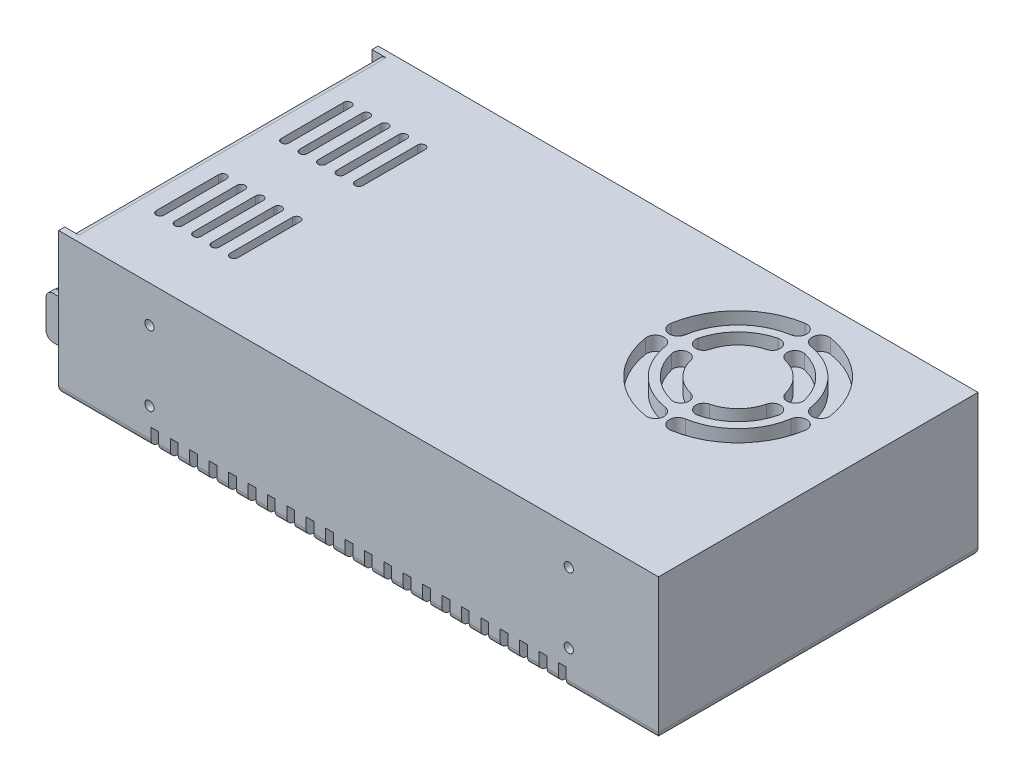
from build123d import *

# Parameters (mm, degrees)
SKETCH1_W                 = 214.63
SKETCH1_H                 = 114.3
BOSS_EXTRUDE1_DEPTH       = 50.8
SKETCH2_W                 = 2.54
SKETCH2_H                 = 109.9312
CUT_EXTRUDE1_DEPTH        = 41.91
SKETCH3_W                 = 89.408
SKETCH3_H                 = 15.24
BOSS_EXTRUDE2_DEPTH       = 12.7
CUT_EXTRUDE3_DEPTH        = 25.4
SKETCH5_W                 = 6.35
SKETCH5_H                 = 8.89
BOSS_EXTRUDE3_DEPTH       = 8.89
SKETCH6_W                 = 8.128
SKETCH6_H                 = 8.128
CUT_EXTRUDE4_DEPTH        = 134.267712478
SKETCH7_R                 = 1.905
CUT_EXTRUDE5_DEPTH        = 0.254
SKETCH8_R                 = 1.905
BOSS_EXTRUDE4_DEPTH       = 2.54
SKETCH9_R                 = 3.81
BOSS_EXTRUDE5_DEPTH       = 3.81
FILLET1_R                 = 1.27
CUT_EXTRUDE6_DEPTH        = 5.08
CUT_EXTRUDE7_DEPTH        = 5.08
FILLET2_R                 = 2.54
CUT_EXTRUDE8_DEPTH        = 6.35
SKETCH13_W                = 89.408
SKETCH13_H                = 15.24
BOSS_EXTRUDE6_DEPTH       = 0.254
FILLET3_R                 = 2.54
SKETCH14_W                = 1.831730769
SKETCH14_H                = 0.488461538
SKETCH14_W_2              = 3.175
SKETCH14_H_2              = 0.427403847
SKETCH14_W_3              = 0.314102564
SKETCH14_H_3              = 4.532051282
CUT_EXTRUDE9_DEPTH        = 0.254
M4X0_7_TAPPED_HOLE1_D     = 3.3
M4X0_7_TAPPED_HOLE1_DEPTH = 9.906
M4X0_7_TAPPED_HOLE1_TIP   = 0.991420021
M4X0_7_TAPPED_HOLE2_D     = 3.3
M4X0_7_TAPPED_HOLE2_DEPTH = 9.906
M4X0_7_TAPPED_HOLE2_TIP   = 0.991420021
M4X0_7_TAPPED_HOLE3_D     = 3.3
M4X0_7_TAPPED_HOLE3_DEPTH = 9.906
M4X0_7_TAPPED_HOLE3_TIP   = 0.991420021


with BuildPart() as part:
    # Sketch1 → Boss-Extrude1 (new body)
    with BuildSketch(Plane(origin=(0, 0, 0), x_dir=(1, 0, 0), z_dir=(0, 1, 0))):
        Rectangle(SKETCH1_W, SKETCH1_H)
    extrude(amount=BOSS_EXTRUDE1_DEPTH)

    # Sketch2 → Cut-Extrude1 (cut)
    with BuildSketch(Plane(origin=(0, 50.8, 0), x_dir=(1, 0, 0), z_dir=(0, 1, 0))):
        with Locations((-106.045, 0)):
            Rectangle(SKETCH2_W, SKETCH2_H)
    extrude(amount=-CUT_EXTRUDE1_DEPTH, mode=Mode.SUBTRACT)

    # Sketch3 → Boss-Extrude2 (add)
    with BuildSketch(Plane.ZY.offset(104.775)):
        with Locations((6.5532, 16.8402)):
            Rectangle(SKETCH3_W, SKETCH3_H)
    extrude(amount=BOSS_EXTRUDE2_DEPTH)

    # Sketch4 → Cut-Extrude3 (cut)
    with BuildSketch(Plane.ZY.offset(104.775)):
        Polygon((-38.1508, 9.2202), (-54.9656, 9.2202), (-54.9656, 27.0002), (54.9656, 27.0002), (54.9656, 9.2202), (51.2572, 9.2202), (51.2572, 24.4602), (-38.1508, 24.4602), align=None)
    extrude(amount=-CUT_EXTRUDE3_DEPTH, mode=Mode.SUBTRACT)

    # Sketch5 → Boss-Extrude3 (add)
    with BuildSketch(Plane(origin=(0, 9.2202, 0), x_dir=(1, 0, 0), z_dir=(0, 1, 0))):
        with Locations((-100.33, 43.4086)):
            Rectangle(SKETCH5_W, SKETCH5_H)
    extrude(amount=BOSS_EXTRUDE3_DEPTH)

    # Sketch6 → Cut-Extrude4 (cut, through all)
    with BuildSketch(Plane(origin=(0, 24.4602, 0), x_dir=(1, 0, 0), z_dir=(0, 1, 0))):
        with Locations((-113.411, 32.0548)):
            Rectangle(SKETCH6_W, SKETCH6_H)
        with Locations((-113.411, 22.4028)):
            Rectangle(SKETCH6_W, SKETCH6_H)
        with Locations((-113.411, 12.7508)):
            Rectangle(SKETCH6_W, SKETCH6_H)
        with Locations((-113.411, 3.0988)):
            Rectangle(SKETCH6_W, SKETCH6_H)
        with Locations((-113.411, -6.5532)):
            Rectangle(SKETCH6_W, SKETCH6_H)
        with Locations((-113.411, -16.2052)):
            Rectangle(SKETCH6_W, SKETCH6_H)
        with Locations((-113.411, -25.8572)):
            Rectangle(SKETCH6_W, SKETCH6_H)
        with Locations((-113.411, -35.5092)):
            Rectangle(SKETCH6_W, SKETCH6_H)
        with Locations((-113.411, -45.1612)):
            Rectangle(SKETCH6_W, SKETCH6_H)
    extrude(amount=-CUT_EXTRUDE4_DEPTH, mode=Mode.SUBTRACT)

    # Sketch7 → Cut-Extrude5 (cut)
    with BuildSketch(Plane.ZY.offset(103.505)):
        with Locations((-43.4086, 13.6652)):
            Circle(SKETCH7_R)
    extrude(amount=-CUT_EXTRUDE5_DEPTH, mode=Mode.SUBTRACT)

    # Sketch8 → Boss-Extrude4 (add)
    with BuildSketch(Plane.ZY.offset(109.347)):
        with Locations(Location((-32.0548, 16.8402, 0), (0, 0, 180))):
            Circle(SKETCH8_R)
        with Locations(Location((-22.4028, 16.8402, 0), (0, 0, 180))):
            Circle(SKETCH8_R)
        with Locations(Location((-12.7508, 16.8402, 0), (0, 0, 180))):
            Circle(SKETCH8_R)
        with Locations(Location((-3.0988, 16.8402, 0), (0, 0, 180))):
            Circle(SKETCH8_R)
        with Locations(Location((6.5532, 16.8402, 0), (0, 0, 180))):
            Circle(SKETCH8_R)
        with Locations(Location((16.2052, 16.8402, 0), (0, 0, 180))):
            Circle(SKETCH8_R)
        with Locations(Location((25.8572, 16.8402, 0), (0, 0, 180))):
            Circle(SKETCH8_R)
        with Locations(Location((35.5092, 16.8402, 0), (0, 0, 180))):
            Circle(SKETCH8_R)
        with Locations(Location((45.1612, 16.8402, 0), (0, 0, 180))):
            Circle(SKETCH8_R)
    extrude(amount=BOSS_EXTRUDE4_DEPTH)

    # Sketch9 → Boss-Extrude5 (add)
    with BuildSketch(Plane.ZY.offset(111.887)):
        with Locations(Location((-32.0548, 16.8402, 0), (0, 0, 180))):
            Circle(SKETCH9_R)
        with Locations(Location((-22.4028, 16.8402, 0), (0, 0, 180))):
            Circle(SKETCH9_R)
        with Locations(Location((-12.7508, 16.8402, 0), (0, 0, 180))):
            Circle(SKETCH9_R)
        with Locations(Location((-3.0988, 16.8402, 0), (0, 0, 180))):
            Circle(SKETCH9_R)
        with Locations(Location((6.5532, 16.8402, 0), (0, 0, 180))):
            Circle(SKETCH9_R)
        with Locations(Location((16.2052, 16.8402, 0), (0, 0, 180))):
            Circle(SKETCH9_R)
        with Locations(Location((25.8572, 16.8402, 0), (0, 0, 180))):
            Circle(SKETCH9_R)
        with Locations(Location((35.5092, 16.8402, 0), (0, 0, 180))):
            Circle(SKETCH9_R)
        with Locations(Location((45.1612, 16.8402, 0), (0, 0, 180))):
            Circle(SKETCH9_R)
    extrude(amount=BOSS_EXTRUDE5_DEPTH)

    # Fillet1
    fillet1_edges = [part.edges().sort_by_distance(p)[0] for p in [
        (-115.697, 16.8402, -28.2448),
        (-115.697, 16.8402, -18.5928),
        (-115.697, 16.8402, -8.9408),
        (-115.697, 16.8402, 0.7112),
        (-115.697, 16.8402, 10.3632),
        (-115.697, 16.8402, 20.0152),
        (-115.697, 16.8402, 29.6672),
        (-115.697, 16.8402, 39.3192),
        (-115.697, 16.8402, 48.9712),
    ]]
    fillet(fillet1_edges, radius=FILLET1_R)

    # Sketch10 → Cut-Extrude6 (cut)
    with BuildSketch(Plane(origin=(0, 50.8, 0), x_dir=(1, 0, 0), z_dir=(0, 1, 0))):
        with BuildLine():
            ThreePointArc((73.119466646, 22.423886792), (69.441281733, 28.928281733), (62.936886792, 32.606466646))
            ThreePointArc((62.936886792, 32.606466646), (60.854086368, 36.069493485), (64.317113208, 38.15229391))
            ThreePointArc((64.317113208, 38.15229391), (73.482396988, 32.969396988), (78.66529391, 23.804113208))
            ThreePointArc((78.66529391, 23.804113208), (76.582493485, 20.341086368), (73.119466646, 22.423886792))
        make_face()
        with BuildLine():
            ThreePointArc((82.013181493, 22.624722359), (75.637658457, 35.124658457), (63.137722359, 41.500181493))
            ThreePointArc((63.137722359, 41.500181493), (60.554209796, 45.062249338), (64.116277641, 47.645761901))
            ThreePointArc((64.116277641, 47.645761901), (80.037983956, 39.524983956), (88.158761901, 23.603277641))
            ThreePointArc((88.158761901, 23.603277641), (85.575249338, 20.041209796), (82.013181493, 22.624722359))
        make_face()
        with BuildLine():
            ThreePointArc((73.119466646, 15.676113208), (76.582493485, 17.758913632), (78.66529391, 14.295886792))
            ThreePointArc((78.66529391, 14.295886792), (73.482396988, 5.130603012), (64.317113208, -0.05229391))
            ThreePointArc((64.317113208, -0.05229391), (60.854086368, 2.030506515), (62.936886792, 5.493533354))
            ThreePointArc((62.936886792, 5.493533354), (69.441281733, 9.171718267), (73.119466646, 15.676113208))
        make_face()
        with BuildLine():
            ThreePointArc((64.116277641, -9.545761901), (60.554209796, -6.962249338), (63.137722359, -3.400181493))
            ThreePointArc((63.137722359, -3.400181493), (75.637658457, 2.975341543), (82.013181493, 15.475277641))
            ThreePointArc((82.013181493, 15.475277641), (85.575249338, 18.058790204), (88.158761901, 14.496722359))
            ThreePointArc((88.158761901, 14.496722359), (80.037983956, -1.424983956), (64.116277641, -9.545761901))
        make_face()
        with BuildLine():
            ThreePointArc((46.006533354, 15.676113208), (49.684718267, 9.171718267), (56.189113208, 5.493533354))
            ThreePointArc((56.189113208, 5.493533354), (58.271913632, 2.030506515), (54.808886792, -0.05229391))
            ThreePointArc((54.808886792, -0.05229391), (45.643603012, 5.130603012), (40.46070609, 14.295886792))
            ThreePointArc((40.46070609, 14.295886792), (42.543506515, 17.758913632), (46.006533354, 15.676113208))
        make_face()
        with BuildLine():
            ThreePointArc((37.112818507, 15.475277641), (43.488341543, 2.975341543), (55.988277641, -3.400181493))
            ThreePointArc((55.988277641, -3.400181493), (58.571790204, -6.962249338), (55.009722359, -9.545761901))
            ThreePointArc((55.009722359, -9.545761901), (39.088016044, -1.424983956), (30.967238099, 14.496722359))
            ThreePointArc((30.967238099, 14.496722359), (33.550750662, 18.058790204), (37.112818507, 15.475277641))
        make_face()
        with BuildLine():
            ThreePointArc((46.006533354, 22.423886792), (42.543506515, 20.341086368), (40.46070609, 23.804113208))
            ThreePointArc((40.46070609, 23.804113208), (45.643603012, 32.969396988), (54.808886792, 38.15229391))
            ThreePointArc((54.808886792, 38.15229391), (58.271913632, 36.069493485), (56.189113208, 32.606466646))
            ThreePointArc((56.189113208, 32.606466646), (49.684718267, 28.928281733), (46.006533354, 22.423886792))
        make_face()
        with BuildLine():
            ThreePointArc((55.009722359, 47.645761901), (58.571790204, 45.062249338), (55.988277641, 41.500181493))
            ThreePointArc((55.988277641, 41.500181493), (43.488341543, 35.124658457), (37.112818507, 22.624722359))
            ThreePointArc((37.112818507, 22.624722359), (33.550750662, 20.041209796), (30.967238099, 23.603277641))
            ThreePointArc((30.967238099, 23.603277641), (39.088016044, 39.524983956), (55.009722359, 47.645761901))
        make_face()
    extrude(amount=-CUT_EXTRUDE6_DEPTH, mode=Mode.SUBTRACT)

    # Sketch11 → Cut-Extrude7 (cut)
    with BuildSketch(Plane(origin=(0, 50.8, 0), x_dir=(1, 0, 0), z_dir=(0, 1, 0))):
        with BuildLine():
            Line((-93.218, 33.528), (-93.218, 11.176))
            ThreePointArc((-93.218, 11.176), (-94.615, 9.779), (-96.012, 11.176))
            Line((-96.012, 11.176), (-96.012, 33.528))
            ThreePointArc((-96.012, 33.528), (-94.615, 34.925), (-93.218, 33.528))
        make_face()
        with BuildLine():
            Line((-93.218, -11.176), (-93.218, -33.528))
            ThreePointArc((-93.218, -33.528), (-94.615, -34.925), (-96.012, -33.528))
            Line((-96.012, -33.528), (-96.012, -11.176))
            ThreePointArc((-96.012, -11.176), (-94.615, -9.779), (-93.218, -11.176))
        make_face()
        with BuildLine():
            Line((-86.614, 33.528), (-86.614, 11.176))
            ThreePointArc((-86.614, 11.176), (-88.011, 9.779), (-89.408, 11.176))
            Line((-89.408, 11.176), (-89.408, 33.528))
            ThreePointArc((-89.408, 33.528), (-88.011, 34.925), (-86.614, 33.528))
        make_face()
        with BuildLine():
            Line((-86.614, -11.176), (-86.614, -33.528))
            ThreePointArc((-86.614, -33.528), (-88.011, -34.925), (-89.408, -33.528))
            Line((-89.408, -33.528), (-89.408, -11.176))
            ThreePointArc((-89.408, -11.176), (-88.011, -9.779), (-86.614, -11.176))
        make_face()
        with BuildLine():
            Line((-80.01, 33.528), (-80.01, 11.176))
            ThreePointArc((-80.01, 11.176), (-81.407, 9.779), (-82.804, 11.176))
            Line((-82.804, 11.176), (-82.804, 33.528))
            ThreePointArc((-82.804, 33.528), (-81.407, 34.925), (-80.01, 33.528))
        make_face()
        with BuildLine():
            Line((-80.01, -11.176), (-80.01, -33.528))
            ThreePointArc((-80.01, -33.528), (-81.407, -34.925), (-82.804, -33.528))
            Line((-82.804, -33.528), (-82.804, -11.176))
            ThreePointArc((-82.804, -11.176), (-81.407, -9.779), (-80.01, -11.176))
        make_face()
        with BuildLine():
            Line((-73.406, 33.528), (-73.406, 11.176))
            ThreePointArc((-73.406, 11.176), (-74.803, 9.779), (-76.2, 11.176))
            Line((-76.2, 11.176), (-76.2, 33.528))
            ThreePointArc((-76.2, 33.528), (-74.803, 34.925), (-73.406, 33.528))
        make_face()
        with BuildLine():
            Line((-73.406, -11.176), (-73.406, -33.528))
            ThreePointArc((-73.406, -33.528), (-74.803, -34.925), (-76.2, -33.528))
            Line((-76.2, -33.528), (-76.2, -11.176))
            ThreePointArc((-76.2, -11.176), (-74.803, -9.779), (-73.406, -11.176))
        make_face()
        with BuildLine():
            Line((-66.802, 33.528), (-66.802, 11.176))
            ThreePointArc((-66.802, 11.176), (-68.199, 9.779), (-69.596, 11.176))
            Line((-69.596, 11.176), (-69.596, 33.528))
            ThreePointArc((-69.596, 33.528), (-68.199, 34.925), (-66.802, 33.528))
        make_face()
        with BuildLine():
            Line((-66.802, -11.176), (-66.802, -33.528))
            ThreePointArc((-66.802, -33.528), (-68.199, -34.925), (-69.596, -33.528))
            Line((-69.596, -33.528), (-69.596, -11.176))
            ThreePointArc((-69.596, -11.176), (-68.199, -9.779), (-66.802, -11.176))
        make_face()
    extrude(amount=-CUT_EXTRUDE7_DEPTH, mode=Mode.SUBTRACT)

    # Fillet2
    fillet2_edges = [part.edges().sort_by_distance(p)[0] for p in [
        (-104.775, 50.8, 0),
        (0, 0, 57.15),
        (-107.315, 0, 0),
        (0, 0, -57.15),
        (107.315, 0, 0),
    ]]
    fillet(fillet2_edges, radius=FILLET2_R)

    # Sketch12 → Cut-Extrude8 (cut)
    with BuildSketch(Plane.XZ):
        with BuildLine():
            Line((71.501, 40.132), (71.501, 57.15))
            ThreePointArc((71.501, 57.15), (72.898, 58.547), (74.295, 57.15))
            Line((74.295, 57.15), (74.295, 40.132))
            ThreePointArc((74.295, 40.132), (72.898, 38.735), (71.501, 40.132))
        make_face()
        with BuildLine():
            Line((64.558333333, 40.132), (64.558333333, 57.15))
            ThreePointArc((64.558333333, 57.15), (65.955333333, 58.547), (67.352333333, 57.15))
            Line((67.352333333, 57.15), (67.352333333, 40.132))
            ThreePointArc((67.352333333, 40.132), (65.955333333, 38.735), (64.558333333, 40.132))
        make_face()
        with BuildLine():
            Line((57.615666667, 40.132), (57.615666667, 57.15))
            ThreePointArc((57.615666667, 57.15), (59.012666667, 58.547), (60.409666667, 57.15))
            Line((60.409666667, 57.15), (60.409666667, 40.132))
            ThreePointArc((60.409666667, 40.132), (59.012666667, 38.735), (57.615666667, 40.132))
        make_face()
        with BuildLine():
            Line((50.673, 40.132), (50.673, 57.15))
            ThreePointArc((50.673, 57.15), (52.07, 58.547), (53.467, 57.15))
            Line((53.467, 57.15), (53.467, 40.132))
            ThreePointArc((53.467, 40.132), (52.07, 38.735), (50.673, 40.132))
        make_face()
        with BuildLine():
            Line((43.730333333, 40.132), (43.730333333, 57.15))
            ThreePointArc((43.730333333, 57.15), (45.127333333, 58.547), (46.524333333, 57.15))
            Line((46.524333333, 57.15), (46.524333333, 40.132))
            ThreePointArc((46.524333333, 40.132), (45.127333333, 38.735), (43.730333333, 40.132))
        make_face()
        with BuildLine():
            Line((36.787666667, 40.132), (36.787666667, 57.15))
            ThreePointArc((36.787666667, 57.15), (38.184666667, 58.547), (39.581666667, 57.15))
            Line((39.581666667, 57.15), (39.581666667, 40.132))
            ThreePointArc((39.581666667, 40.132), (38.184666667, 38.735), (36.787666667, 40.132))
        make_face()
        with BuildLine():
            Line((29.845, 40.132), (29.845, 57.15))
            ThreePointArc((29.845, 57.15), (31.242, 58.547), (32.639, 57.15))
            Line((32.639, 57.15), (32.639, 40.132))
            ThreePointArc((32.639, 40.132), (31.242, 38.735), (29.845, 40.132))
        make_face()
        with BuildLine():
            Line((22.902333333, 40.132), (22.902333333, 57.15))
            ThreePointArc((22.902333333, 57.15), (24.299333333, 58.547), (25.696333333, 57.15))
            Line((25.696333333, 57.15), (25.696333333, 40.132))
            ThreePointArc((25.696333333, 40.132), (24.299333333, 38.735), (22.902333333, 40.132))
        make_face()
        with BuildLine():
            Line((15.959666667, 40.132), (15.959666667, 57.15))
            ThreePointArc((15.959666667, 57.15), (17.356666667, 58.547), (18.753666667, 57.15))
            Line((18.753666667, 57.15), (18.753666667, 40.132))
            ThreePointArc((18.753666667, 40.132), (17.356666667, 38.735), (15.959666667, 40.132))
        make_face()
        with BuildLine():
            Line((9.017, 40.132), (9.017, 57.15))
            ThreePointArc((9.017, 57.15), (10.414, 58.547), (11.811, 57.15))
            Line((11.811, 57.15), (11.811, 40.132))
            ThreePointArc((11.811, 40.132), (10.414, 38.735), (9.017, 40.132))
        make_face()
        with BuildLine():
            Line((2.074333333, 40.132), (2.074333333, 57.15))
            ThreePointArc((2.074333333, 57.15), (3.471333333, 58.547), (4.868333333, 57.15))
            Line((4.868333333, 57.15), (4.868333333, 40.132))
            ThreePointArc((4.868333333, 40.132), (3.471333333, 38.735), (2.074333333, 40.132))
        make_face()
        with BuildLine():
            Line((-4.868333333, 40.132), (-4.868333333, 57.15))
            ThreePointArc((-4.868333333, 57.15), (-3.471333333, 58.547), (-2.074333333, 57.15))
            Line((-2.074333333, 57.15), (-2.074333333, 40.132))
            ThreePointArc((-2.074333333, 40.132), (-3.471333333, 38.735), (-4.868333333, 40.132))
        make_face()
        with BuildLine():
            Line((-11.811, 40.132), (-11.811, 57.15))
            ThreePointArc((-11.811, 57.15), (-10.414, 58.547), (-9.017, 57.15))
            Line((-9.017, 57.15), (-9.017, 40.132))
            ThreePointArc((-9.017, 40.132), (-10.414, 38.735), (-11.811, 40.132))
        make_face()
        with BuildLine():
            Line((-18.753666667, 40.132), (-18.753666667, 57.15))
            ThreePointArc((-18.753666667, 57.15), (-17.356666667, 58.547), (-15.959666667, 57.15))
            Line((-15.959666667, 57.15), (-15.959666667, 40.132))
            ThreePointArc((-15.959666667, 40.132), (-17.356666667, 38.735), (-18.753666667, 40.132))
        make_face()
        with BuildLine():
            Line((-25.696333333, 40.132), (-25.696333333, 57.15))
            ThreePointArc((-25.696333333, 57.15), (-24.299333333, 58.547), (-22.902333333, 57.15))
            Line((-22.902333333, 57.15), (-22.902333333, 40.132))
            ThreePointArc((-22.902333333, 40.132), (-24.299333333, 38.735), (-25.696333333, 40.132))
        make_face()
        with BuildLine():
            Line((-32.639, 40.132), (-32.639, 57.15))
            ThreePointArc((-32.639, 57.15), (-31.242, 58.547), (-29.845, 57.15))
            Line((-29.845, 57.15), (-29.845, 40.132))
            ThreePointArc((-29.845, 40.132), (-31.242, 38.735), (-32.639, 40.132))
        make_face()
        with BuildLine():
            Line((-39.581666667, 40.132), (-39.581666667, 57.15))
            ThreePointArc((-39.581666667, 57.15), (-38.184666667, 58.547), (-36.787666667, 57.15))
            Line((-36.787666667, 57.15), (-36.787666667, 40.132))
            ThreePointArc((-36.787666667, 40.132), (-38.184666667, 38.735), (-39.581666667, 40.132))
        make_face()
        with BuildLine():
            Line((-46.524333333, 40.132), (-46.524333333, 57.15))
            ThreePointArc((-46.524333333, 57.15), (-45.127333333, 58.547), (-43.730333333, 57.15))
            Line((-43.730333333, 57.15), (-43.730333333, 40.132))
            ThreePointArc((-43.730333333, 40.132), (-45.127333333, 38.735), (-46.524333333, 40.132))
        make_face()
        with BuildLine():
            Line((-53.467, 40.132), (-53.467, 57.15))
            ThreePointArc((-53.467, 57.15), (-52.07, 58.547), (-50.673, 57.15))
            Line((-50.673, 57.15), (-50.673, 40.132))
            ThreePointArc((-50.673, 40.132), (-52.07, 38.735), (-53.467, 40.132))
        make_face()
        with BuildLine():
            Line((-60.409666667, 40.132), (-60.409666667, 57.15))
            ThreePointArc((-60.409666667, 57.15), (-59.012666667, 58.547), (-57.615666667, 57.15))
            Line((-57.615666667, 57.15), (-57.615666667, 40.132))
            ThreePointArc((-57.615666667, 40.132), (-59.012666667, 38.735), (-60.409666667, 40.132))
        make_face()
        with BuildLine():
            Line((-67.352333333, 40.132), (-67.352333333, 57.15))
            ThreePointArc((-67.352333333, 57.15), (-65.955333333, 58.547), (-64.558333333, 57.15))
            Line((-64.558333333, 57.15), (-64.558333333, 40.132))
            ThreePointArc((-64.558333333, 40.132), (-65.955333333, 38.735), (-67.352333333, 40.132))
        make_face()
        with BuildLine():
            Line((-74.295, 40.132), (-74.295, 57.15))
            ThreePointArc((-74.295, 57.15), (-72.898, 58.547), (-71.501, 57.15))
            Line((-71.501, 57.15), (-71.501, 40.132))
            ThreePointArc((-71.501, 40.132), (-72.898, 38.735), (-74.295, 40.132))
        make_face()
    cut_extrude8 = extrude(amount=-CUT_EXTRUDE8_DEPTH, mode=Mode.SUBTRACT)

    # Mirror1: Cut-Extrude8 across plane
    add(cut_extrude8.mirror(Plane.XY), mode=Mode.SUBTRACT)

    # Sketch13 → Boss-Extrude6 (add)
    with BuildSketch(Plane.ZY.offset(117.475)):
        with Locations((6.5532, 16.8402)):
            Rectangle(SKETCH13_W, SKETCH13_H)
    extrude(amount=BOSS_EXTRUDE6_DEPTH)

    # Fillet3
    # the kernel refuses this fillet: 2.54 mm, written as the material it takes off along each edge
    with BuildSketch(Plane(origin=(-117.729, 9.2202, -44.5008), x_dir=(1, 0, 0), z_dir=(0, 0, 1))) as fillet3_piece_1:
        with BuildLine():
            CenterArc((FILLET3_R, FILLET3_R), FILLET3_R, 180, 90)
            Line((0, FILLET3_R), (0, 0))
            Line((0, 0), (FILLET3_R, 0))
        make_face()
    extrude(amount=102.108, mode=Mode.SUBTRACT)
    with BuildSketch(Plane(origin=(-117.729, 24.4602, 57.6072), x_dir=(0, -1, 0), z_dir=(0, 0, -1))) as fillet3_piece_2:
        with BuildLine():
            CenterArc((FILLET3_R, -FILLET3_R), FILLET3_R, 90, 90)
            Line((0, -FILLET3_R), (0, 0))
            Line((0, 0), (FILLET3_R, 0))
        make_face()
    extrude(amount=102.108, mode=Mode.SUBTRACT)

    # Sketch14 → Cut-Extrude9 (cut)
    # profile 1 of 15: a face of its own
    with BuildSketch(Plane.ZY.offset(104.775)):
        Polygon((-51.057907692, 38.1127), (-50.599975, 38.1127), (-49.012475, 34.359559976), (-47.424975, 38.1127), (-46.967042308, 38.1127), (-48.981946154, 33.3502), (-49.043003846, 33.3502), align=None)
    # profile 2 of 15: a face of its own
    with BuildSketch(Plane.ZY.offset(104.775)):
        Polygon((-26.634830769, 35.914623077), (-26.634830769, 37.31895), (-26.207426923, 37.31895), (-26.207426923, 35.914623077), (-24.8031, 35.914623077), (-24.8031, 35.487219231), (-26.207426923, 35.487219231), (-26.207426923, 34.082892308), (-26.634830769, 34.082892308), (-26.634830769, 35.487219231), (-28.039157692, 35.487219231), (-28.039157692, 35.914623077), align=None)
    # profile 3 of 15: a face of its own
    with BuildSketch(Plane.ZY.offset(104.775)):
        Polygon((-24.131465385, 38.1127), (-23.673532692, 38.1127), (-22.086032692, 34.359559976), (-20.498532692, 38.1127), (-20.0406, 38.1127), (-22.055503846, 33.3502), (-22.116561538, 33.3502), align=None)
    # profile 4 of 15: a face of its own
    with BuildSketch(Plane.ZY.offset(104.775)):
        with Locations((3.283438462, 35.181930769)):
            Rectangle(SKETCH14_W, SKETCH14_H)
    # profile 5 of 15: a face of its own
    with BuildSketch(Plane.ZY.offset(104.775)):
        Polygon((4.626707692, 38.1127), (5.084640385, 38.1127), (6.672140385, 34.359559976), (8.259640385, 38.1127), (8.717573077, 38.1127), (6.702669231, 33.3502), (6.641611538, 33.3502), align=None)
    # profile 6 of 15: a face of its own
    with BuildSketch(Plane.ZY.offset(104.775)):
        with Locations((25.569496154, 36.433613462)):
            Rectangle(SKETCH14_W_2, SKETCH14_H_2)
    # profile 7 of 15: a face of its own
    with BuildSketch(Plane.ZY.offset(104.775)):
        with Locations((25.569496154, 35.029286539)):
            Rectangle(SKETCH14_W_2, SKETCH14_H_2)
    # profile 8 of 15: a face of its own
    with BuildSketch(Plane.ZY.offset(104.775)):
        Polygon((33.690169231, 33.3502), (33.690169231, 38.1127), (33.779847716, 38.1127), (36.926226923, 34.364330108), (36.926226923, 38.1127), (37.353630769, 38.1127), (37.353630769, 33.3502), (37.256320072, 33.3502), (34.117573077, 37.089983654), (34.117573077, 33.3502), align=None)
    # profile 9 of 15: a face of its own
    with BuildSketch(Plane.ZY.offset(104.775)):
        Polygon((42.238246154, 38.1127), (42.66565, 38.1127), (42.66565, 33.838661538), (44.497380769, 33.838661538), (44.497380769, 33.3502), (42.238246154, 33.3502), align=None)
    # profile 10 of 15: a face of its own
    with BuildSketch(Plane.ZY.offset(104.775)):
        with BuildLine():
            Line((-43.927138462, 35.907892308), (-43.927138462, 33.3502))
            Line((-43.927138462, 33.3502), (-44.241241026, 33.3502))
            Line((-44.241241026, 33.3502), (-44.241241026, 33.792607853))
            add(Edge.make_bspline(
                [(-44.241241026, 33.792607853), (-44.276659816, 33.752568259), (-44.345780032, 33.674430488), (-44.46122115, 33.572348315), (-44.583589327, 33.487969993), (-44.712290649, 33.419820078), (-44.847208892, 33.368628021), (-44.988044979, 33.332241862), (-45.13485636, 33.308848027), (-45.235108715, 33.306512005), (-45.2859125, 33.305328205)],
                knots=[0, 0, 0, 0, 1.074387032, 2.096679803, 3.090159297, 4.057316773, 5.018401886, 5.985159533, 6.978961417, 8, 8, 8, 8], degree=3))
            add(Edge.make_bspline(
                [(-45.2859125, 33.305328205), (-45.331080454, 33.306554577), (-45.420153659, 33.308973038), (-45.551182736, 33.327735341), (-45.677274985, 33.357865963), (-45.798549558, 33.399766853), (-45.914221703, 33.455347674), (-46.0252818, 33.521888922), (-46.131154492, 33.601129752), (-46.230226031, 33.691717781), (-46.321458031, 33.790112768), (-46.401519304, 33.895058315), (-46.468272384, 34.006100619), (-46.524092465, 34.121833773), (-46.567088809, 34.243148692), (-46.597062443, 34.36962586), (-46.61580289, 34.501115734), (-46.618220351, 34.590655257), (-46.619446154, 34.636057372)],
                knots=[0, 0, 0, 0, 1.033919861, 2.038935746, 3.024066025, 3.998881131, 4.97069526, 5.957263378, 6.95902576, 7.993208707, 9.027059324, 10.027763471, 11.009749337, 11.988697705, 12.965288445, 13.950418724, 14.960734635, 16, 16, 16, 16], degree=3))
            add(Edge.make_bspline(
                [(-46.619446154, 34.636057372), (-46.618193182, 34.680521075), (-46.615716126, 34.768423419), (-46.597262906, 34.897702117), (-46.566231897, 35.022220377), (-46.522684049, 35.141577321), (-46.466842094, 35.255917371), (-46.398914007, 35.365321396), (-46.318894883, 35.470090793), (-46.226642476, 35.56776202), (-46.126707706, 35.657982634), (-46.019798975, 35.73639168), (-45.908575693, 35.804108529), (-45.791312683, 35.857762005), (-45.669745578, 35.901171109), (-45.542792132, 35.931204078), (-45.410980554, 35.948901399), (-45.321490062, 35.951464163), (-45.276096795, 35.952764103)],
                knots=[0, 0, 0, 0, 1.020392517, 2.01726096, 2.990465484, 3.961182959, 4.928053699, 5.906110375, 6.912531644, 7.948652711, 8.985773172, 9.998621852, 10.987621588, 11.969261332, 12.953316658, 13.946091881, 14.958173133, 16, 16, 16, 16], degree=3))
            add(Edge.make_bspline(
                [(-45.276096795, 35.952764103), (-45.223896936, 35.951326351), (-45.121535476, 35.948506988), (-44.971807467, 35.925044261), (-44.830162989, 35.885405794), (-44.695508637, 35.831488296), (-44.568327951, 35.759839567), (-44.449824966, 35.669459606), (-44.338759483, 35.560918419), (-44.274379191, 35.477547974), (-44.241241026, 35.434635096)],
                knots=[0, 0, 0, 0, 1.038897134, 2.037228247, 3.008116434, 3.962042015, 4.918381754, 5.904844433, 6.921570401, 8, 8, 8, 8], degree=3))
            Line((-44.241241026, 35.434635096), (-44.241241026, 35.907892308))
            Line((-44.241241026, 35.907892308), (-43.927138462, 35.907892308))
        make_face()
        with BuildLine():
            add(Edge.make_bspline(
                [(-45.271890064, 35.638661538), (-45.317804402, 35.637027901), (-45.408432002, 35.63380336), (-45.541476004, 35.608629865), (-45.668789418, 35.56674527), (-45.789735492, 35.509463369), (-45.902403709, 35.437434632), (-46.00309738, 35.350313249), (-46.092640081, 35.250476235), (-46.167948345, 35.138374125), (-46.229338842, 35.018196033), (-46.272505874, 34.892571595), (-46.300975122, 34.763766618), (-46.303883642, 34.676403932), (-46.30534359, 34.632551763)],
                knots=[0, 0, 0, 0, 1.031046209, 2.035121221, 3.029706178, 4.034933723, 5.034054252, 6.02443088, 7.017295772, 8.038157696, 9.050218397, 10.03989886, 11.016116709, 12, 12, 12, 12], degree=3))
            add(Edge.make_bspline(
                [(-46.30534359, 34.632551763), (-46.303478696, 34.588961656), (-46.29975622, 34.5019523), (-46.273005525, 34.372971723), (-46.228125652, 34.247317681), (-46.166883589, 34.126056687), (-46.090196964, 34.013472587), (-46.001308312, 33.911732464), (-45.89935803, 33.824242876), (-45.786430523, 33.751005303), (-45.665822553, 33.691842782), (-45.538988621, 33.650677142), (-45.408312983, 33.624099362), (-45.319460649, 33.620994885), (-45.274694551, 33.619430769)],
                knots=[0, 0, 0, 0, 0.979072187, 1.954306742, 2.945804271, 3.96968567, 4.997920485, 5.998718438, 6.996577872, 8.005894225, 9.015743152, 10.005417472, 10.995077863, 12, 12, 12, 12], degree=3))
            add(Edge.make_bspline(
                [(-45.274694551, 33.619430769), (-45.229248049, 33.621090733), (-45.138859462, 33.624392237), (-45.005420754, 33.649673502), (-44.875925791, 33.6914423), (-44.752138563, 33.749341427), (-44.636822432, 33.821098783), (-44.533324554, 33.905105874), (-44.445808586, 34.002809058), (-44.371615976, 34.110185511), (-44.31344056, 34.227897508), (-44.2710645, 34.353231698), (-44.246010595, 34.486192447), (-44.242852865, 34.577056374), (-44.241241026, 34.623437179)],
                knots=[0, 0, 0, 0, 1.01762866, 2.023962475, 3.030623092, 4.058876274, 5.077231937, 6.066672613, 7.034107872, 8.005628644, 8.981990164, 9.965428785, 10.961468474, 12, 12, 12, 12], degree=3))
            add(Edge.make_bspline(
                [(-44.241241026, 34.623437179), (-44.242200682, 34.65877501), (-44.244089589, 34.728331043), (-44.258520159, 34.830458561), (-44.281475085, 34.928192287), (-44.313821255, 35.021634976), (-44.35631254, 35.110269991), (-44.407560306, 35.194733752), (-44.468465755, 35.274586963), (-44.538048452, 35.348730034), (-44.614213654, 35.416356496), (-44.694808195, 35.476720737), (-44.780786942, 35.52630951), (-44.870703979, 35.567350781), (-44.964715313, 35.600009931), (-45.063585933, 35.621797625), (-45.16626492, 35.636757946), (-45.236310975, 35.638020327), (-45.271890064, 35.638661538)],
                knots=[0, 0, 0, 0, 1.050140795, 2.067009409, 3.05949893, 4.030605086, 5.00011959, 5.97591094, 6.962425594, 7.979863591, 8.993523472, 9.986985069, 10.967611495, 11.937549037, 12.921786183, 13.919465291, 14.943216303, 16, 16, 16, 16], degree=3))
        make_face(mode=Mode.SUBTRACT)
    # profile 11 of 15: a face of its own
    with BuildSketch(Plane.ZY.offset(104.775)):
        with BuildLine():
            Line((-40.606625641, 36.93994359), (-40.606625641, 33.3502))
            Line((-40.606625641, 33.3502), (-40.920728205, 33.3502))
            Line((-40.920728205, 33.3502), (-40.920728205, 33.792607853))
            add(Edge.make_bspline(
                [(-40.920728205, 33.792607853), (-40.956146996, 33.752568259), (-41.025267211, 33.674430488), (-41.140708329, 33.572348315), (-41.263076507, 33.487969993), (-41.391777828, 33.419820078), (-41.526696071, 33.368628021), (-41.667532159, 33.332241862), (-41.81434354, 33.308848027), (-41.914595894, 33.306512005), (-41.965399679, 33.305328205)],
                knots=[0, 0, 0, 0, 1.074387032, 2.096679803, 3.090159297, 4.057316773, 5.018401886, 5.985159533, 6.978961417, 8, 8, 8, 8], degree=3))
            add(Edge.make_bspline(
                [(-41.965399679, 33.305328205), (-42.010567633, 33.306554577), (-42.099640838, 33.308973038), (-42.230669915, 33.327735341), (-42.356762165, 33.357865963), (-42.478036737, 33.399766853), (-42.593708883, 33.455347674), (-42.70476898, 33.521888922), (-42.810641672, 33.601129752), (-42.909713211, 33.691717781), (-43.000945211, 33.790112768), (-43.081006484, 33.895058315), (-43.147759563, 34.006100619), (-43.203579644, 34.121833773), (-43.246575989, 34.243148692), (-43.276549623, 34.36962586), (-43.29529007, 34.501115734), (-43.29770753, 34.590655257), (-43.298933333, 34.636057372)],
                knots=[0, 0, 0, 0, 1.033919861, 2.038935746, 3.024066025, 3.998881131, 4.97069526, 5.957263378, 6.95902576, 7.993208707, 9.027059324, 10.027763471, 11.009749337, 11.988697705, 12.965288445, 13.950418724, 14.960734635, 16, 16, 16, 16], degree=3))
            add(Edge.make_bspline(
                [(-43.298933333, 34.636057372), (-43.297680362, 34.680521075), (-43.295203305, 34.768423419), (-43.276750085, 34.897702117), (-43.245719077, 35.022220377), (-43.202171229, 35.141577321), (-43.146329274, 35.255917371), (-43.078401187, 35.365321396), (-42.998382062, 35.470090793), (-42.906129655, 35.56776202), (-42.806194885, 35.657982634), (-42.699286154, 35.73639168), (-42.588062873, 35.804108529), (-42.470799862, 35.857762005), (-42.349232758, 35.901171109), (-42.222279312, 35.931204078), (-42.090467733, 35.948901399), (-42.000977241, 35.951464163), (-41.955583974, 35.952764103)],
                knots=[0, 0, 0, 0, 1.020392517, 2.01726096, 2.990465484, 3.961182959, 4.928053699, 5.906110375, 6.912531644, 7.948652711, 8.985773172, 9.998621852, 10.987621588, 11.969261332, 12.953316658, 13.946091881, 14.958173133, 16, 16, 16, 16], degree=3))
            add(Edge.make_bspline(
                [(-41.955583974, 35.952764103), (-41.903367167, 35.951197007), (-41.800871376, 35.948120971), (-41.650972854, 35.922414604), (-41.509185244, 35.879251726), (-41.374692256, 35.820160445), (-41.248295696, 35.743359694), (-41.129069056, 35.650608246), (-41.019085733, 35.5392811), (-40.95401391, 35.455669526), (-40.920728205, 35.412900321)],
                knots=[0, 0, 0, 0, 1.031072012, 2.023879775, 2.993683497, 3.952812103, 4.918022106, 5.908088563, 6.929940113, 8, 8, 8, 8], degree=3))
            Line((-40.920728205, 35.412900321), (-40.920728205, 36.93994359))
            Line((-40.920728205, 36.93994359), (-40.606625641, 36.93994359))
        make_face()
        with BuildLine():
            add(Edge.make_bspline(
                [(-41.951377244, 35.638661538), (-41.997291581, 35.637027901), (-42.087919181, 35.63380336), (-42.220963183, 35.608629865), (-42.348276598, 35.56674527), (-42.469222672, 35.509463369), (-42.581890888, 35.437434632), (-42.682584559, 35.350313249), (-42.772127261, 35.250476235), (-42.847435525, 35.138374125), (-42.908826022, 35.018196033), (-42.951993054, 34.892571595), (-42.980462301, 34.763766618), (-42.983370822, 34.676403932), (-42.984830769, 34.632551763)],
                knots=[0, 0, 0, 0, 1.031046209, 2.035121221, 3.029706178, 4.034933723, 5.034054252, 6.02443088, 7.017295772, 8.038157696, 9.050218397, 10.03989886, 11.016116709, 12, 12, 12, 12], degree=3))
            add(Edge.make_bspline(
                [(-42.984830769, 34.632551763), (-42.982965876, 34.588961656), (-42.979243399, 34.5019523), (-42.952492705, 34.372971723), (-42.907612831, 34.247317681), (-42.846370768, 34.126056687), (-42.769684144, 34.013472587), (-42.680795491, 33.911732464), (-42.57884521, 33.824242876), (-42.465917703, 33.751005303), (-42.345309732, 33.691842782), (-42.218475801, 33.650677142), (-42.087800163, 33.624099362), (-41.998947829, 33.620994885), (-41.954181731, 33.619430769)],
                knots=[0, 0, 0, 0, 0.979072187, 1.954306742, 2.945804271, 3.96968567, 4.997920485, 5.998718438, 6.996577872, 8.005894225, 9.015743152, 10.005417472, 10.995077863, 12, 12, 12, 12], degree=3))
            add(Edge.make_bspline(
                [(-41.954181731, 33.619430769), (-41.908735228, 33.621090733), (-41.818346641, 33.624392237), (-41.684907934, 33.649673502), (-41.555412971, 33.6914423), (-41.431625742, 33.749341427), (-41.316309611, 33.821098783), (-41.212811734, 33.905105874), (-41.125295765, 34.002809058), (-41.051103156, 34.110185511), (-40.992927739, 34.227897508), (-40.95055168, 34.353231698), (-40.925497774, 34.486192447), (-40.922340044, 34.577056374), (-40.920728205, 34.623437179)],
                knots=[0, 0, 0, 0, 1.01762866, 2.023962475, 3.030623092, 4.058876274, 5.077231937, 6.066672613, 7.034107872, 8.005628644, 8.981990164, 9.965428785, 10.961468474, 12, 12, 12, 12], degree=3))
            add(Edge.make_bspline(
                [(-40.920728205, 34.623437179), (-40.921687861, 34.65877501), (-40.923576769, 34.728331043), (-40.938007338, 34.830458561), (-40.960962265, 34.928192287), (-40.993308435, 35.021634976), (-41.035799719, 35.110269991), (-41.087047485, 35.194733752), (-41.147952935, 35.274586963), (-41.217535631, 35.348730034), (-41.293700834, 35.416356496), (-41.374295374, 35.476720737), (-41.460274121, 35.52630951), (-41.550191158, 35.567350781), (-41.644202493, 35.600009931), (-41.743073112, 35.621797625), (-41.845752099, 35.636757946), (-41.915798155, 35.638020327), (-41.951377244, 35.638661538)],
                knots=[0, 0, 0, 0, 1.050140795, 2.067009409, 3.05949893, 4.030605086, 5.00011959, 5.97591094, 6.962425594, 7.979863591, 8.993523472, 9.986985069, 10.967611495, 11.937549037, 12.921786183, 13.919465291, 14.943216303, 16, 16, 16, 16], degree=3))
        make_face(mode=Mode.SUBTRACT)
    # profile 12 of 15: a face of its own
    with BuildSketch(Plane.ZY.offset(104.775)):
        with BuildLine():
            add(Edge.make_bspline(
                [(-39.776497436, 36.984815385), (-39.756776723, 36.983917905), (-39.718383173, 36.982170633), (-39.663076108, 36.96716046), (-39.613314571, 36.941019679), (-39.568754, 36.907063861), (-39.53137757, 36.865970244), (-39.50424396, 36.819157658), (-39.488192145, 36.767781764), (-39.485966307, 36.732289291), (-39.484830769, 36.714182372)],
                knots=[0, 0, 0, 0, 1.06928763, 2.081757757, 3.080304056, 4.102817284, 5.108909582, 6.075019406, 7.017947647, 8, 8, 8, 8], degree=3))
            add(Edge.make_bspline(
                [(-39.484830769, 36.714182372), (-39.4859884, 36.696545877), (-39.488272203, 36.661752165), (-39.50423201, 36.611259991), (-39.531604212, 36.565103709), (-39.568728977, 36.524089945), (-39.613321139, 36.490153601), (-39.66307435, 36.464007687), (-39.718383644, 36.448998888), (-39.756776882, 36.447251425), (-39.776497436, 36.446353846)],
                knots=[0, 0, 0, 0, 0.962634111, 1.899108286, 2.860048811, 3.872254101, 4.900980094, 5.905593535, 6.924215405, 8, 8, 8, 8], degree=3))
            add(Edge.make_bspline(
                [(-39.776497436, 36.446353846), (-39.796217989, 36.447251425), (-39.834611228, 36.448998888), (-39.889920522, 36.464007687), (-39.939673733, 36.490153601), (-39.984265895, 36.524089945), (-40.021390659, 36.565103709), (-40.048762862, 36.611259991), (-40.064722669, 36.661752165), (-40.067006472, 36.696545877), (-40.068164103, 36.714182372)],
                knots=[0, 0, 0, 0, 1.075784595, 2.094406465, 3.099019906, 4.127745899, 5.139951189, 6.100891714, 7.037365889, 8, 8, 8, 8], degree=3))
            add(Edge.make_bspline(
                [(-40.068164103, 36.714182372), (-40.067028565, 36.732289291), (-40.064802727, 36.767781764), (-40.048750912, 36.819157658), (-40.021617301, 36.865970244), (-39.984240872, 36.907063861), (-39.939680301, 36.941019679), (-39.889918764, 36.96716046), (-39.834611699, 36.982170633), (-39.796218149, 36.983917905), (-39.776497436, 36.984815385)],
                knots=[0, 0, 0, 0, 0.982052353, 1.924980594, 2.891090418, 3.897182716, 4.919695944, 5.918242243, 6.93071237, 8, 8, 8, 8], degree=3))
        make_face()
    # profile 13 of 15: a face of its own
    with BuildSketch(Plane.ZY.offset(104.775)):
        with BuildLine():
            Line((-39.933548718, 35.907892308), (-39.619446154, 35.907892308))
            Line((-39.619446154, 35.907892308), (-39.619446154, 32.976502083))
            add(Edge.make_bspline(
                [(-39.619446154, 32.976502083), (-39.619546412, 32.950545544), (-39.619739068, 32.900667681), (-39.625910965, 32.82864315), (-39.633917243, 32.761865864), (-39.645591708, 32.700413307), (-39.661038423, 32.644335895), (-39.680000609, 32.593992346), (-39.701329847, 32.548317625), (-39.727744772, 32.508978115), (-39.756466479, 32.474452966), (-39.787746093, 32.444579212), (-39.821412305, 32.418980822), (-39.85825606, 32.398883865), (-39.897078604, 32.382214174), (-39.938712093, 32.371471054), (-39.982586394, 32.363918441), (-40.012740765, 32.363324838), (-40.02820016, 32.363020513)],
                knots=[0, 0, 0, 0, 1.493029139, 2.868991889, 4.156754484, 5.362105958, 6.464967428, 7.499106053, 8.455465818, 9.358121702, 10.217355437, 11.035397588, 11.842309395, 12.643033568, 13.444773531, 14.266895717, 15.11148054, 16, 16, 16, 16], degree=3))
            add(Edge.make_bspline(
                [(-40.02820016, 32.363020513), (-40.055382942, 32.363959701), (-40.11156287, 32.365900767), (-40.197839763, 32.382875111), (-40.289162248, 32.407818625), (-40.350435463, 32.431399397), (-40.382266667, 32.443649519)],
                knots=[0, 0, 0, 0, 0.892368802, 1.844300437, 2.88012224, 4, 4, 4, 4], degree=3))
            Line((-40.382266667, 32.443649519), (-40.382266667, 32.745833013))
            add(Edge.make_bspline(
                [(-40.382266667, 32.745833013), (-40.362405613, 32.735240981), (-40.324508558, 32.715030229), (-40.266509461, 32.694571617), (-40.212180793, 32.67958077), (-40.176460315, 32.67792031), (-40.159309936, 32.677123077)],
                knots=[0, 0, 0, 0, 1.144578483, 2.183980519, 3.128079311, 4, 4, 4, 4], degree=3))
            add(Edge.make_bspline(
                [(-40.159309936, 32.677123077), (-40.139481119, 32.678396533), (-40.101240163, 32.680852464), (-40.047917888, 32.702045854), (-40.002967623, 32.738016805), (-39.98222352, 32.77034566), (-39.971409295, 32.787199199)],
                knots=[0, 0, 0, 0, 1.036054724, 1.998088038, 2.956371939, 4, 4, 4, 4], degree=3))
            add(Edge.make_bspline(
                [(-39.971409295, 32.787199199), (-39.96526893, 32.801998267), (-39.950900497, 32.836628034), (-39.941085636, 32.901420582), (-39.934200692, 32.983798671), (-39.933779734, 33.045180414), (-39.933548718, 33.078865865)],
                knots=[0, 0, 0, 0, 0.647276487, 1.514624746, 2.636060416, 4, 4, 4, 4], degree=3))
            Line((-39.933548718, 33.078865865), (-39.933548718, 35.907892308))
        make_face()
    # profile 14 of 15: a face of its own
    with BuildSketch(Plane.ZY.offset(104.775)):
        with Locations((-8.007266667, 34.673917949)):
            Rectangle(SKETCH14_W_3, SKETCH14_H_3)
    # profile 15 of 15: a face of its own
    with BuildSketch(Plane.ZY.offset(104.775)):
        with Locations((19.49914359, 34.673917949)):
            Rectangle(SKETCH14_W_3, SKETCH14_H_3)
    extrude(amount=-CUT_EXTRUDE9_DEPTH, mode=Mode.SUBTRACT)

    # M4x0.7 Tapped Hole1
    with Locations(Plane(origin=(0, 0, -57.15), x_dir=(-1, 0, 0), z_dir=(0, 0, -1))):
        with Locations((75.565, 12.7), (-75.565, 12.7)):
            Hole(M4X0_7_TAPPED_HOLE1_D / 2, depth=M4X0_7_TAPPED_HOLE1_DEPTH)
            with Locations((0, 0, -(M4X0_7_TAPPED_HOLE1_DEPTH + M4X0_7_TAPPED_HOLE1_TIP / 2))):  # 118° drill point
                Cone(0, M4X0_7_TAPPED_HOLE1_D / 2, M4X0_7_TAPPED_HOLE1_TIP, mode=Mode.SUBTRACT)

    # M4x0.7 Tapped Hole2
    with Locations(Plane.XY.offset(57.15)):
        with Locations((75.185, 12.7), (75.185, 37.7), (-74.815, 37.7), (-74.815, 12.7)):
            Hole(M4X0_7_TAPPED_HOLE2_D / 2, depth=M4X0_7_TAPPED_HOLE2_DEPTH)
            with Locations((0, 0, -(M4X0_7_TAPPED_HOLE2_DEPTH + M4X0_7_TAPPED_HOLE2_TIP / 2))):  # 118° drill point
                Cone(0, M4X0_7_TAPPED_HOLE2_D / 2, M4X0_7_TAPPED_HOLE2_TIP, mode=Mode.SUBTRACT)

    # M4x0.7 Tapped Hole3
    with Locations(Plane(origin=(0, 0, 0), x_dir=(-1, 0, 0), z_dir=(0, -1, 0))):
        with Locations((-75.185, -25.35), (-75.185, 24.65), (74.815, 24.65), (74.815, -25.35)):
            Hole(M4X0_7_TAPPED_HOLE3_D / 2, depth=M4X0_7_TAPPED_HOLE3_DEPTH)
            with Locations((0, 0, -(M4X0_7_TAPPED_HOLE3_DEPTH + M4X0_7_TAPPED_HOLE3_TIP / 2))):  # 118° drill point
                Cone(0, M4X0_7_TAPPED_HOLE3_D / 2, M4X0_7_TAPPED_HOLE3_TIP, mode=Mode.SUBTRACT)


solid = part.part
